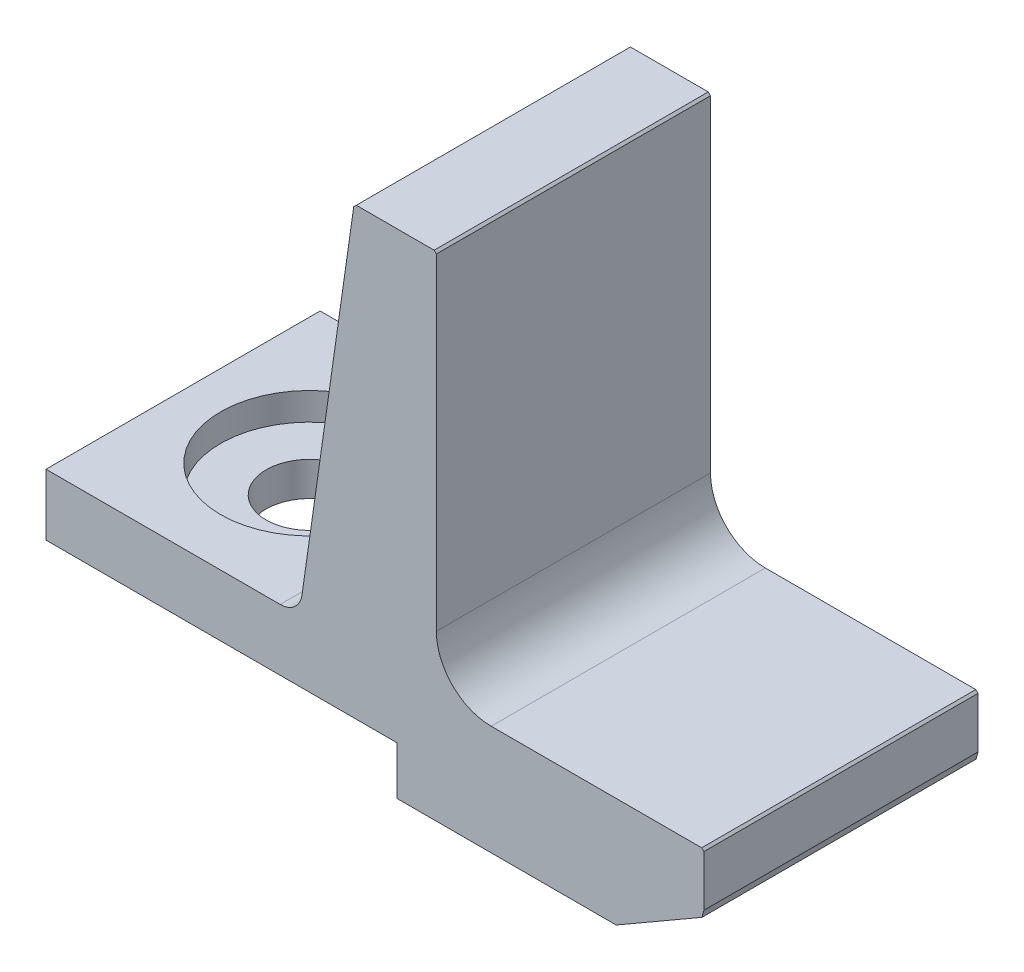
from build123d import *
from OCP.BRepFilletAPI import BRepFilletAPI_MakeChamfer

# Parameters (mm, degrees)
BOSS_EXTRUDE1_DEPTH                                  = 31.75
CBORE_FOR_3_8_BINDING_HEAD_MACHINE_SCREW_D           = 10.0838
CBORE_FOR_3_8_BINDING_HEAD_MACHINE_SCREW_CBORE_D     = 20.6375
CBORE_FOR_3_8_BINDING_HEAD_MACHINE_SCREW_CBORE_DEPTH = 3.175
CHAMFER1_SIZE                                        = 10.16
CHAMFER1_SIZE2                                       = 5.865878735
FILLET1_R                                            = 2.54
FILLET2_R                                            = 6.35
CHAMFER2_SIZE                                        = 0.254
CHAMFER2_SIZE2                                       = 0.693940905
CHAMFER2_SIZE2_2                                     = 0.299341871


with BuildPart() as part:
    # Sketch1 → Boss-Extrude1 (new body)
    with BuildSketch(Plane.XY):
        Polygon((0, 0), (30.988, 0), (30.988, -12.7), (-4.572, -12.7), (-4.572, -7.112), (-45.212, -7.112), (-45.212, 0), (-15.875, 0), (-9.525, 44.45), (0, 44.45), align=None)
    extrude(amount=BOSS_EXTRUDE1_DEPTH)

    # CBORE for 3/8 Binding Head Machine Screw1 (through all)
    with Locations(Plane(origin=(0, 0, 0), x_dir=(1, 0, 0), z_dir=(0, 1, 0))):
        with Locations((-30.5435, -15.875)):
            CounterBoreHole(CBORE_FOR_3_8_BINDING_HEAD_MACHINE_SCREW_D / 2, CBORE_FOR_3_8_BINDING_HEAD_MACHINE_SCREW_CBORE_D / 2, CBORE_FOR_3_8_BINDING_HEAD_MACHINE_SCREW_CBORE_DEPTH)

    # Chamfer1
    chamfer1_edges = [part.edges().sort_by_distance(p)[0] for p in [
        (30.988, -12.7, 15.875),
    ]]
    chamfer1_side = [part.faces().sort_by_distance(p)[0] for p in [
        (13.208, -12.7, 15.875),
    ]]
    chamfer(chamfer1_edges, length=CHAMFER1_SIZE, length2=CHAMFER1_SIZE2, reference=chamfer1_side[0])

    # Fillet1
    fillet1_edges = [part.edges().sort_by_distance(p)[0] for p in [
        (-15.875, 0, 15.875),
    ]]
    fillet(fillet1_edges, radius=FILLET1_R)

    # Fillet2
    fillet2_edges = [part.edges().sort_by_distance(p)[0] for p in [
        (0, 0, 15.875),
    ]]
    fillet(fillet2_edges, radius=FILLET2_R)

    # Chamfer2: one chamfer whose edges measure the first distance from different faces: ONE call of the kernel's chamfer builder (chamfer() names one face for all edges)
    chamfer2_edges_1 = [part.edges().sort_by_distance(p)[0] for p in [
        (30.988, -6.834121265, 15.875),
    ]]
    chamfer2_side_1 = [part.faces().sort_by_distance(p)[0] for p in [
        (25.908, -9.767060633, 15.875),
    ]]
    chamfer2_edges_2 = [part.edges().sort_by_distance(p)[0] for p in [
        (30.988, 0, 15.875),
        (0, 44.45, 15.875),
    ]]
    chamfer2_edges_3 = [part.edges().sort_by_distance(p)[0] for p in [
        (-9.525, 44.45, 15.875),
    ]]
    chamfer2_side_3 = [part.faces().sort_by_distance(p)[0] for p in [
        (-4.7625, 44.45, 15.875),
    ]]
    chamfer2 = BRepFilletAPI_MakeChamfer(part.part.solid().wrapped)
    for e in chamfer2_edges_1:
        chamfer2.Add(CHAMFER2_SIZE, CHAMFER2_SIZE2, e.wrapped, chamfer2_side_1[0].wrapped)  # the first distance lies on this face
    for e in chamfer2_edges_2:
        chamfer2.Add(CHAMFER2_SIZE, e.wrapped)
    for e in chamfer2_edges_3:
        chamfer2.Add(CHAMFER2_SIZE, CHAMFER2_SIZE2_2, e.wrapped, chamfer2_side_3[0].wrapped)  # the first distance lies on this face
    add(Compound.cast(chamfer2.Shape()), mode=Mode.REPLACE)


solid = part.part
